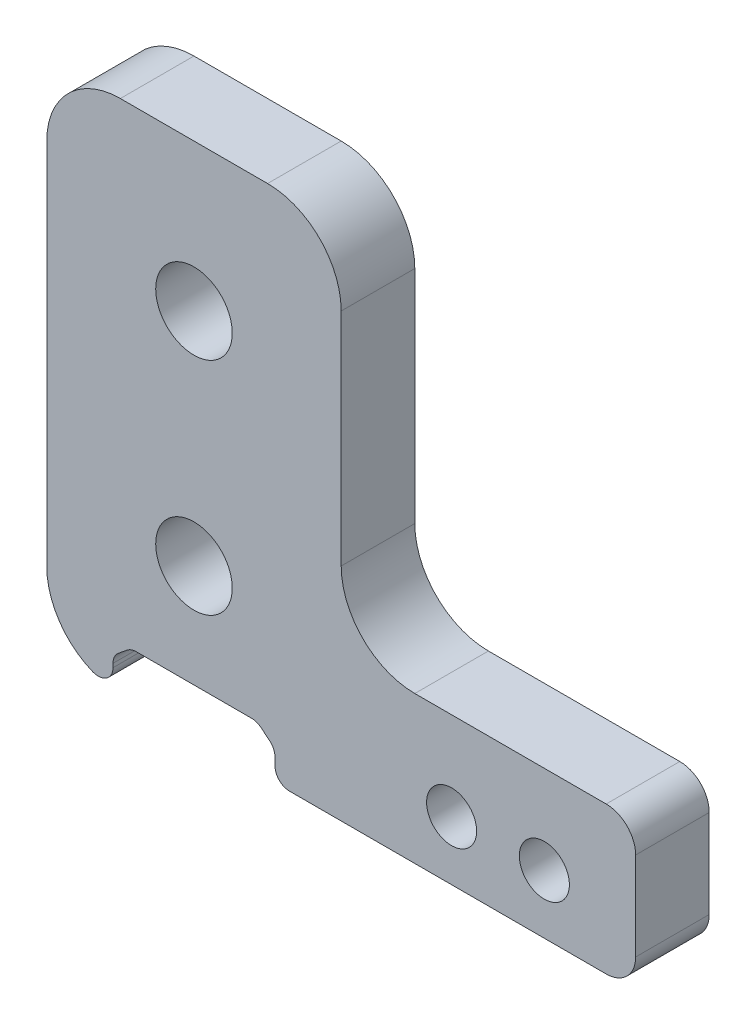
from build123d import *

# Parameters (mm, degrees)
BOSS_EXTRUDE1_DEPTH = 5
SKETCH5_R           = 2.6
CUT_EXTRUDE1_DEPTH  = 5
CUT_EXTRUDE2_REACH  = 55.385
SKETCH6_R           = 1.7
CUT_EXTRUDE4_REACH  = 55.385
FILLET4_R           = 1
FILLET1_R           = 5
FILLET2_R           = 2
FILLET5_R           = 1


with BuildPart() as part:
    # Sketch3 → Boss-Extrude1 (new body)
    with BuildSketch(Plane.XY):
        Polygon((20, -35), (40, -35), (40, -25), (20, -25), (20, 0), (0, 0), (0, -35), align=None)
    extrude(amount=BOSS_EXTRUDE1_DEPTH)

    # Sketch5 → Cut-Extrude1 (cut)
    with BuildSketch(Plane(origin=(0, 0, 0), x_dir=(-1, 0, 0), z_dir=(0, 0, -1))):
        with BuildLine():
            ThreePointArc((-7.4, -10), (-8.161522369, -8.161522369), (-10, -7.4))
            Line((-10, -7.4), (-10, -12.6))
            ThreePointArc((-10, -12.6), (-8.161522369, -11.838477631), (-7.4, -10))
        make_face()
        with BuildLine():
            Line((-10, -12.6), (-10, -7.4))
            ThreePointArc((-10, -7.4), (-12.6, -10), (-10, -12.6))
        make_face()
        with Locations((-10, -25)):
            Circle(SKETCH5_R)
    extrude(amount=-CUT_EXTRUDE1_DEPTH, mode=Mode.SUBTRACT)

    # Sketch6 → Cut-Extrude2 (cut, up to next)
    with BuildSketch(Plane(origin=(0, 0, 0), x_dir=(-1, 0, 0), z_dir=(0, 0, -1)), mode=Mode.PRIVATE) as cut_extrude2_sk1:
        with Locations((-27.5, -31)):
            Circle(SKETCH6_R)
    cut_extrude2_tool1 = extrude(cut_extrude2_sk1.sketch, amount=-CUT_EXTRUDE2_REACH, mode=Mode.PRIVATE) & part.part
    # Sketch6 → Cut-Extrude2 (cut, up to next)
    with BuildSketch(Plane(origin=(0, 0, 0), x_dir=(-1, 0, 0), z_dir=(0, 0, -1)), mode=Mode.PRIVATE) as cut_extrude2_sk2:
        with Locations((-33.8, -31)):
            Circle(SKETCH6_R)
    cut_extrude2_tool2 = extrude(cut_extrude2_sk2.sketch, amount=-CUT_EXTRUDE2_REACH, mode=Mode.PRIVATE) & part.part
    add(cut_extrude2_tool1.solids().sort_by_distance((27.5, -31, 0))[0], mode=Mode.SUBTRACT)
    add(cut_extrude2_tool2.solids().sort_by_distance((33.8, -31, 0))[0], mode=Mode.SUBTRACT)

    # Sketch8 → Cut-Extrude4 (cut, up to next)
    with BuildSketch(Plane(origin=(0, 0, 0), x_dir=(-1, 0, 0), z_dir=(0, 0, -1)), mode=Mode.PRIVATE) as cut_extrude4_sk1:
        Polygon((-4.5, -35), (-4.5, -33), (-5.726444717, -32), (-14.273555283, -32), (-15.5, -33), (-15.5, -35), align=None)
    cut_extrude4_tool1 = extrude(cut_extrude4_sk1.sketch, amount=-CUT_EXTRUDE4_REACH, mode=Mode.PRIVATE) & part.part
    add(cut_extrude4_tool1.solids().sort_by_distance((10, -33.545033, 0))[0], mode=Mode.SUBTRACT)

    # Fillet4
    fillet4_edges = [part.edges().sort_by_distance(p)[0] for p in [
        (5.726444717, -32, 2.5),
        (4.5, -33, 2.5),
        (15.5, -35, 2.5),
        (15.5, -33, 2.5),
        (14.273555283, -32, 2.5),
    ]]
    fillet(fillet4_edges, radius=FILLET4_R)

    # Fillet1
    # the kernel refuses this fillet: 5 mm, written as the material it adds along each edge
    with BuildSketch(Plane(origin=(20, -25, 0), x_dir=(1, 0, 0), z_dir=(0, 0, 1))) as fillet1_piece_1:
        with BuildLine():
            CenterArc((FILLET1_R, FILLET1_R), FILLET1_R, 180, 90)
            Line((0, FILLET1_R), (0, 0))
            Line((0, 0), (FILLET1_R, 0))
        make_face()
    extrude(amount=5)
    # the kernel refuses this fillet: 5 mm, written as the material it takes off along each edge
    with BuildSketch(Plane(origin=(0, -35, -12.437342964), x_dir=(0, 1, 0), z_dir=(0, 0, 1))) as fillet1_2_piece_1:
        with BuildLine():
            CenterArc((4.974937186, -5), FILLET1_R, 90, 84.260829523)
            Line((0, -4.5), (0, 0))
            Line((0, 0), (4.974937186, 0))
        make_face()
    extrude(amount=29.874685928, mode=Mode.SUBTRACT)
    with BuildSketch(Plane(origin=(0, 0, -12.5), x_dir=(1, 0, 0), z_dir=(0, 0, 1)), Plane(origin=(20, 0, -12.5), x_dir=(0, -1, 0), z_dir=(0, 0, 1))) as fillet1_2_piece_2:
        with BuildLine():
            CenterArc((FILLET1_R, -FILLET1_R), FILLET1_R, 90, 90)
            Line((0, -FILLET1_R), (0, 0))
            Line((0, 0), (FILLET1_R, 0))
        make_face()
    extrude(amount=30, mode=Mode.SUBTRACT)

    # Fillet2
    fillet2_edges = [part.edges().sort_by_distance(p)[0] for p in [
        (40, -35, 2.5),
        (40, -25, 2.5),
    ]]
    fillet(fillet2_edges, radius=FILLET2_R)

    # Fillet5
    fillet5_edges = [part.edges().sort_by_distance(p)[0] for p in [
        (4.5, -35, 2.5),
    ]]
    fillet(fillet5_edges, radius=FILLET5_R)


solid = part.part
